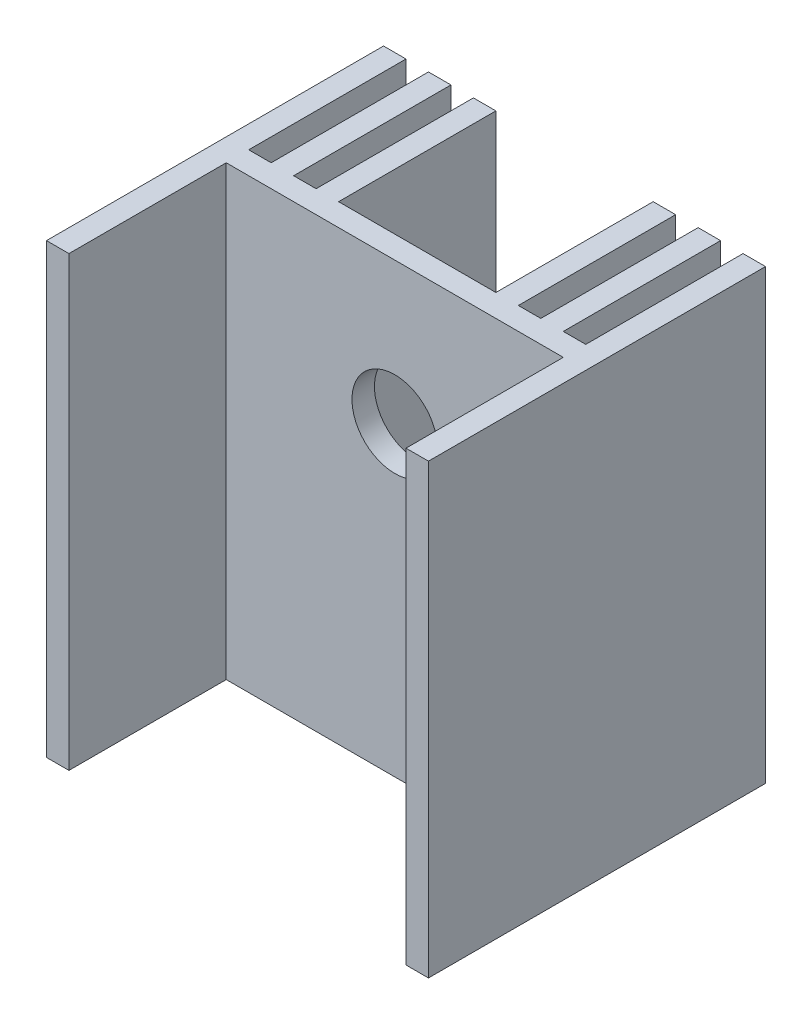
from build123d import *

# Parameters (mm, degrees)
SKETCH11_W              = 17
SKETCH11_H              = 19.920243607
BOSS_EXTRUDE7_DEPTH     = 1
BOSS_EXTRUDE5_START     = -2.131780543
BOSS_EXTRUDE5_OUTLINE_W = 1
BOSS_EXTRUDE5_OUTLINE_H = 7
BOSS_EXTRUDE5_DEPTH     = 19.920243607
SKETCH13_W              = 1
SKETCH13_H              = 19.920243607
BOSS_EXTRUDE6_DEPTH     = 7
LPATTERN3_COUNT         = 7
LPATTERN3_PITCH         = 2
CUT_EXTRUDE1_REACH      = 23.276
SKETCH14_R              = 1.905


# Read off the part's stored shape, not the designer's step: Boss-Extrude5
with BuildPart() as part:
    # Sketch11 (on Front Plane) → Boss-Extrude7 (new body)
    with BuildSketch(Plane.XY):
        with Locations((0, 7.828341261)):
            Rectangle(SKETCH11_W, SKETCH11_H)
    extrude(amount=-BOSS_EXTRUDE7_DEPTH)

    # Boss-Extrude5 outline → Boss-Extrude5 (add)
    with BuildSketch(Plane(origin=(0, 0, 0), x_dir=(1, 0, 0), z_dir=(0, 1, 0)).offset(BOSS_EXTRUDE5_START)):
        with Locations((-8, 4.5)):
            Rectangle(BOSS_EXTRUDE5_OUTLINE_W, BOSS_EXTRUDE5_OUTLINE_H)
        with Locations((-8, -3.5)):
            Rectangle(BOSS_EXTRUDE5_OUTLINE_W, BOSS_EXTRUDE5_OUTLINE_H)
    boss_extrude5 = extrude(amount=BOSS_EXTRUDE5_DEPTH)

    # Mirror1: Boss-Extrude5 across plane
    add(boss_extrude5.mirror(Plane(origin=(0, 0, 0), x_dir=(0, 0, 1), z_dir=(1, 0, 0))))

    # Sketch13 → Boss-Extrude6 (add, through all)
    with BuildSketch(Plane(origin=(0, 0, -1), x_dir=(-1, 0, 0), z_dir=(0, 0, -1))):
        with Locations((6, 7.828341261)):
            Rectangle(SKETCH13_W, SKETCH13_H)
    boss_extrude6 = extrude(amount=BOSS_EXTRUDE6_DEPTH)

    # LPattern3: Boss-Extrude6 ×7, 3 skipped
    with Locations(*[(i * LPATTERN3_PITCH, 0, 0) for i in range(1, LPATTERN3_COUNT) if i not in (2, 3, 4)]):
        add(boss_extrude6)

    # Sketch14 → Cut-Extrude1 (cut, up to next)
    with BuildSketch(Plane.XY, mode=Mode.PRIVATE) as cut_extrude1_sk1:
        with Locations((0, 11.468219457)):
            Circle(SKETCH14_R)
    cut_extrude1_tool1 = extrude(cut_extrude1_sk1.sketch, amount=-CUT_EXTRUDE1_REACH, mode=Mode.PRIVATE) & part.part
    add(cut_extrude1_tool1.solids().sort_by_distance((0, 11.468219, 0))[0], mode=Mode.SUBTRACT)


solid = part.part
